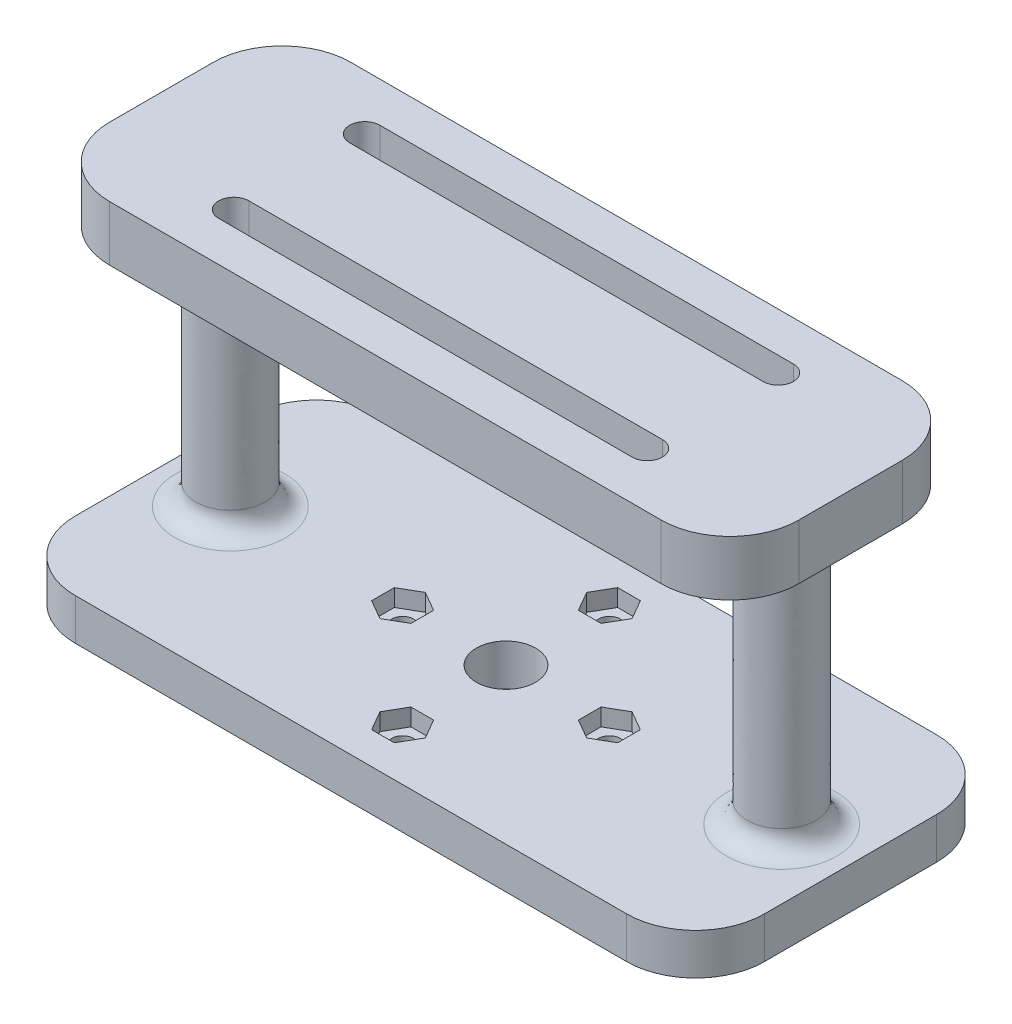
from build123d import *

# Parameters (mm, degrees)
LOWER_MOUNTING_PLATE_DEPTH             = 8
LOWER_MOUNTING_PLATE_COUNTERBORE_DEPTH = 3
SKETCH4_R                              = 1.6
SKETCH4_R_2                            = 4.3
UPPER_MOUNTING_PLATE_DEPTH             = 6
UPPER_MOUNTING_HOLES_COUTERBORE_DEPTH  = 2.5
LOFT_SUPPORT_1_DEPTH                   = 39
LOFT_SUPPORT_2_DEPTH                   = 39
LOFT_SUPPORT_FILLETS_R                 = 3


# Read off the part's stored shape, not the designer's step: Loft Support 1, Loft Support 2
with BuildPart() as part:
    # Sketch2 → Lower Mounting Plate (new body)
    with BuildSketch(Plane(origin=(0, 39, 0), x_dir=(1, 0, 0), z_dir=(0, 1, 0))):
        with BuildLine():
            Line((-40, 17.5), (40, 17.5))
            ThreePointArc((40, 17.5), (47.071067812, 14.571067812), (50, 7.5))
            Line((50, 7.5), (50, -7.5))
            ThreePointArc((50, -7.5), (47.071067812, -14.571067812), (40, -17.5))
            Line((40, -17.5), (-40, -17.5))
            ThreePointArc((-40, -17.5), (-47.071067812, -14.571067812), (-50, -7.5))
            Line((-50, -7.5), (-50, 7.5))
            ThreePointArc((-50, 7.5), (-47.071067812, 14.571067812), (-40, 17.5))
        make_face()
        with BuildLine():
            Line((-30, 11.7), (30, 11.7))
            ThreePointArc((30, 11.7), (32.2, 9.5), (30, 7.3))
            Line((30, 7.3), (-30, 7.3))
            ThreePointArc((-30, 7.3), (-32.2, 9.5), (-30, 11.7))
        make_face(mode=Mode.SUBTRACT)
        with BuildLine():
            Line((-30, -11.7), (30, -11.7))
            ThreePointArc((30, -11.7), (32.2, -9.5), (30, -7.3))
            Line((30, -7.3), (-30, -7.3))
            ThreePointArc((-30, -7.3), (-32.2, -9.5), (-30, -11.7))
        make_face(mode=Mode.SUBTRACT)
    extrude(amount=LOWER_MOUNTING_PLATE_DEPTH)

    # Sketch3 → Lower Mounting Plate Counterbore (cut)
    with BuildSketch(Plane(origin=(0, 39, 0), x_dir=(1, 0, 0), z_dir=(0, 1, 0))):
        with BuildLine():
            Line((-32.7, 13.2), (32.7, 13.2))
            ThreePointArc((32.7, 13.2), (33.407106781, 12.907106781), (33.7, 12.2))
            Line((33.7, 12.2), (33.7, 6.8))
            ThreePointArc((33.7, 6.8), (33.407106781, 6.092893219), (32.7, 5.8))
            Line((32.7, 5.8), (-32.7, 5.8))
            ThreePointArc((-32.7, 5.8), (-33.407106781, 6.092893219), (-33.7, 6.8))
            Line((-33.7, 6.8), (-33.7, 12.2))
            ThreePointArc((-33.7, 12.2), (-33.407106781, 12.907106781), (-32.7, 13.2))
        make_face()
        with BuildLine():
            Line((-32.7, -5.8), (32.7, -5.8))
            ThreePointArc((32.7, -5.8), (33.407106781, -6.092893219), (33.7, -6.8))
            Line((33.7, -6.8), (33.7, -12.2))
            ThreePointArc((33.7, -12.2), (33.407106781, -12.907106781), (32.7, -13.2))
            Line((32.7, -13.2), (-32.7, -13.2))
            ThreePointArc((-32.7, -13.2), (-33.407106781, -12.907106781), (-33.7, -12.2))
            Line((-33.7, -12.2), (-33.7, -6.8))
            ThreePointArc((-33.7, -6.8), (-33.407106781, -6.092893219), (-32.7, -5.8))
        make_face()
    extrude(amount=LOWER_MOUNTING_PLATE_COUNTERBORE_DEPTH, mode=Mode.SUBTRACT)



with BuildPart() as body_2:
    # Sketch4 → Upper Mounting Plate (new body)
    with BuildSketch(Plane(origin=(0, 0, 0), x_dir=(1, 0, 0), z_dir=(0, 1, 0))):
        with BuildLine():
            Line((-40, 22.5), (40, 22.5))
            ThreePointArc((40, 22.5), (47.071067812, 19.571067812), (50, 12.5))
            Line((50, 12.5), (50, -12.5))
            ThreePointArc((50, -12.5), (47.071067812, -19.571067812), (40, -22.5))
            Line((40, -22.5), (-40, -22.5))
            ThreePointArc((-40, -22.5), (-47.071067812, -19.571067812), (-50, -12.5))
            Line((-50, -12.5), (-50, 12.5))
            ThreePointArc((-50, 12.5), (-47.071067812, 19.571067812), (-40, 22.5))
        make_face()
        with Locations(Location((0, 15, 0), (0, 0, 270))):
            Circle(SKETCH4_R, mode=Mode.SUBTRACT)
        with Locations(Location((15, 0, 0), (0, 0, 270))):
            Circle(SKETCH4_R, mode=Mode.SUBTRACT)
        with Locations(Location((0, -15, 0), (0, 0, 270))):
            Circle(SKETCH4_R, mode=Mode.SUBTRACT)
        with Locations(Location((-15, 0, 0), (0, 0, 270))):
            Circle(SKETCH4_R, mode=Mode.SUBTRACT)
        with Locations(Location((0, 0, 0), (0, 0, 270))):
            Circle(SKETCH4_R_2, mode=Mode.SUBTRACT)
    extrude(amount=-UPPER_MOUNTING_PLATE_DEPTH)

    # Sketch5 → Upper Mounting Holes Couterbore (cut)
    with BuildSketch(Plane(origin=(0, 0, 0), x_dir=(1, 0, 0), z_dir=(0, 1, 0))):
        Polygon((17.85, -1.645448267), (17.85, 1.645448267), (15, 3.290896534), (12.15, 1.645448267), (12.15, -1.645448267), (15, -3.290896534), align=None)
        Polygon((1.645448267, 17.85), (-1.645448267, 17.85), (-3.290896534, 15), (-1.645448267, 12.15), (1.645448267, 12.15), (3.290896534, 15), align=None)
        Polygon((-1.645448267, -17.85), (1.645448267, -17.85), (3.290896534, -15), (1.645448267, -12.15), (-1.645448267, -12.15), (-3.290896534, -15), align=None)
        Polygon((-17.85, 1.645448267), (-17.85, -1.645448267), (-15, -3.290896534), (-12.15, -1.645448267), (-12.15, 1.645448267), (-15, 3.290896534), align=None)
    extrude(amount=-UPPER_MOUNTING_HOLES_COUTERBORE_DEPTH, mode=Mode.SUBTRACT)


with BuildPart() as part_1:
    add(part.part)

    add(body_2.part)  # Loft Support 1 merges body 2
    # Loft Support 1 outline → Loft Support 1 (add)
    with BuildSketch(Plane(origin=(0, 0, 0), x_dir=(1, 0, 0), z_dir=(0, 1, 0))):
        with BuildLine():
            add(Edge.make_bspline(
                [(-35, 0), (-35, 0.137978752), (-35.011202125, 0.411340507), (-35.06032073, 0.812304931), (-35.140463797, 1.202900191), (-35.799723236, 3.476511034), (-37.79233996, 5), (-42.75957505, 5), (-45, 2.75957505), (-45, -2.75957505), (-42.75957505, -5), (-37.79233996, -5), (-35.799723236, -3.476511034), (-35.140463797, -1.202900191), (-35.06032073, -0.812304931), (-35.011202125, -0.411340507), (-35, -0.137978752), (-35, 0)],
                knots=[0, 0, 0, 0, 0.0125, 0.025, 0.0375, 0.05, 0.25, 0.25, 0.5, 0.5, 0.75, 0.75, 0.95, 0.9625, 0.975, 0.9875, 1, 1, 1, 1], degree=3))
        make_face()
    extrude(amount=LOFT_SUPPORT_1_DEPTH)

    # Loft Support 2 outline → Loft Support 2 (add)
    with BuildSketch(Plane(origin=(0, 0, 0), x_dir=(1, 0, 0), z_dir=(0, 1, 0))):
        with BuildLine():
            add(Edge.make_bspline(
                [(35, 0), (35, -0.137978752), (35.011202125, -0.411340507), (35.06032073, -0.812304931), (35.140463797, -1.202900191), (35.799723236, -3.476511034), (37.79233996, -5), (42.75957505, -5), (45, -2.75957505), (45, 2.75957505), (42.75957505, 5), (37.79233996, 5), (35.799723236, 3.476511034), (35.140463797, 1.202900191), (35.06032073, 0.812304931), (35.011202125, 0.411340507), (35, 0.137978752), (35, 0)],
                knots=[0, 0, 0, 0, 0.0125, 0.025, 0.0375, 0.05, 0.25, 0.25, 0.5, 0.5, 0.75, 0.75, 0.95, 0.9625, 0.975, 0.9875, 1, 1, 1, 1], degree=3))
        make_face()
    extrude(amount=LOFT_SUPPORT_2_DEPTH)

    # Loft Support Fillets
    loft_support_fillets_edges = [part_1.edges().sort_by_distance(p)[0] for p in [
        (45, 0, 0),
        (-45, 0, 0),
        (45, 39, 0),
        (-45, 39, 0),
    ]]
    fillet(loft_support_fillets_edges, radius=LOFT_SUPPORT_FILLETS_R)


solid = part_1.part
